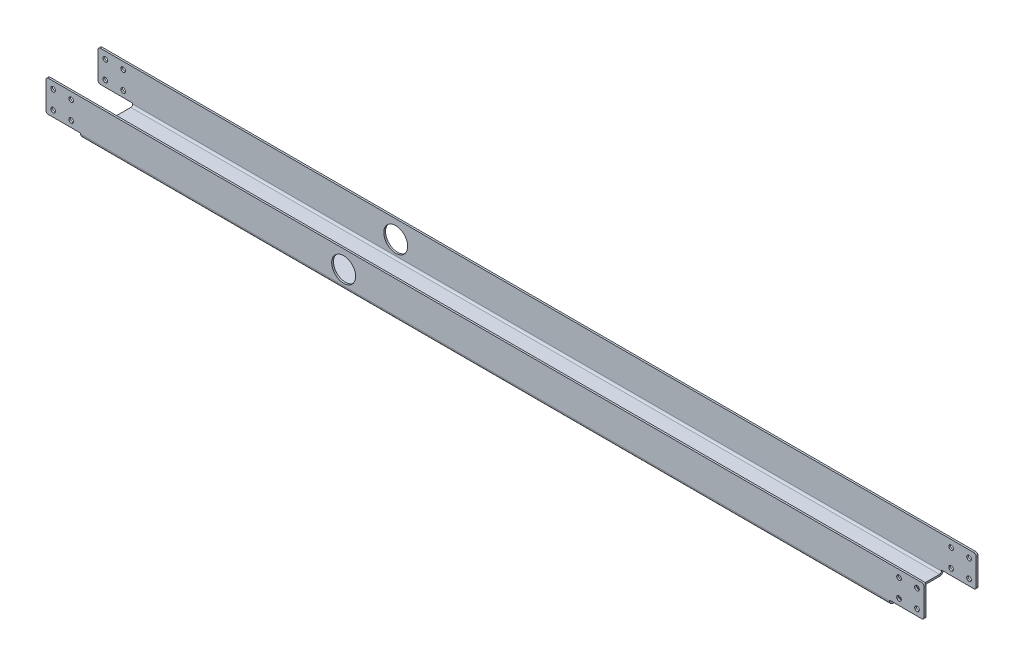
from build123d import *

# Parameters (mm, degrees)
SKETCH1_W                    = 858.52
SKETCH1_H                    = 57.15
BASE_FLANGE1_DEPTH           = 1.89738
EDGE_FLANGE1_STRIP_W         = 11.65352
EDGE_FLANGE1_STRIP_H         = 1.89738
EDGE_FLANGE1_STRIP_CUT_DEPTH = 858.52
EDGE_FLANGE1_DEPTH           = 858.52
EDGE_FLANGE1_FLAT_DEPTH      = 1.89738
EDGE_FLANGE2_STRIP_W         = 11.65352
EDGE_FLANGE2_STRIP_H         = 1.89738
EDGE_FLANGE2_STRIP_CUT_DEPTH = 858.52
EDGE_FLANGE2_DEPTH           = 858.52
EDGE_FLANGE2_FLAT_DEPTH      = 1.89738
SKETCH12_R                   = 2.4638
CUT_EXTRUDE1_DEPTH           = 471.97413973
FILLET1_R                    = 2.54
SKETCH13_R                   = 12.7
CUT_EXTRUDE2_DEPTH           = 471.97413973


# Sheet-metal steps are written as plain solids
with BuildPart() as part:
    # Sketch1 → Base-Flange1 (new body)
    with BuildSketch(Plane(origin=(0, 0, 0), x_dir=(1, 0, 0), z_dir=(0, 1, 0))):
        Rectangle(SKETCH1_W, SKETCH1_H)
    extrude(amount=-BASE_FLANGE1_DEPTH)

    # Edge-Flange1 strip (across the edge) → Edge-Flange1 strip cut (cut)
    with BuildSketch(Plane(origin=(-429.26, 0, 28.575), x_dir=(0, 0, -1), z_dir=(1, 0, 0))):
        with Locations((-1.89738, -0.94869)):
            Rectangle(EDGE_FLANGE1_STRIP_W, EDGE_FLANGE1_STRIP_H)
    extrude(amount=EDGE_FLANGE1_STRIP_CUT_DEPTH, mode=Mode.SUBTRACT)

    # Edge-Flange1 bend section (across the edge) → Edge-Flange1 (add)
    with BuildSketch(Plane(origin=(-429.26, 0, 28.575), x_dir=(0, 0, -1), z_dir=(1, 0, 0))):
        with BuildLine():
            Line((0, 2.032), (1.89738, 2.032))
            ThreePointArc((1.89738, 2.032), (2.492539021, 0.595159021), (3.92938, 0))
            Line((3.92938, 0), (3.92938, -1.89738))
            ThreePointArc((3.92938, -1.89738), (1.150888756, -0.746491244), (0, 2.032))
        make_face()
    extrude(amount=EDGE_FLANGE1_DEPTH)

    # Edge-Flange1 profile (on flange) → Edge-Flange1 flat (add)
    with BuildSketch(Plane(origin=(0, 0, 28.575), x_dir=(-1, 0, 0), z_dir=(0, 0, -1))):
        Polygon((466.09, 36.20262), (-466.09, 36.20262), (-466.09, 2.87782), (-429.26, 2.87782), (-429.26, 2.032), (429.26, 2.032), (429.26, 2.87782), (466.09, 2.87782), align=None)
    extrude(amount=EDGE_FLANGE1_FLAT_DEPTH)

    # Edge-Flange2 strip (across the edge) → Edge-Flange2 strip cut (cut)
    with BuildSketch(Plane(origin=(429.26, 0, -28.575), x_dir=(0, 0, 1), z_dir=(-1, 0, 0))):
        with Locations((-1.89738, -0.94869)):
            Rectangle(EDGE_FLANGE2_STRIP_W, EDGE_FLANGE2_STRIP_H)
    extrude(amount=EDGE_FLANGE2_STRIP_CUT_DEPTH, mode=Mode.SUBTRACT)

    # Edge-Flange2 bend section (across the edge) → Edge-Flange2 (add)
    with BuildSketch(Plane(origin=(429.26, 0, -28.575), x_dir=(0, 0, 1), z_dir=(-1, 0, 0))):
        with BuildLine():
            Line((0, 2.032), (1.89738, 2.032))
            ThreePointArc((1.89738, 2.032), (2.492539021, 0.595159021), (3.92938, 0))
            Line((3.92938, 0), (3.92938, -1.89738))
            ThreePointArc((3.92938, -1.89738), (1.150888756, -0.746491244), (0, 2.032))
        make_face()
    extrude(amount=EDGE_FLANGE2_DEPTH)

    # Edge-Flange2 profile (on flange) → Edge-Flange2 flat (add)
    with BuildSketch(Plane.XY.offset(-28.575)):
        Polygon((466.09, 36.20262), (-466.09, 36.20262), (-466.09, 2.87782), (-429.26, 2.87782), (-429.26, 2.032), (429.26, 2.032), (429.26, 2.87782), (466.09, 2.87782), align=None)
    extrude(amount=EDGE_FLANGE2_FLAT_DEPTH)

    # Sketch12 → Cut-Extrude1 (cut, through all)
    with BuildSketch(Plane.XY.offset(28.575)):
        with Locations((-458.47, 28.58262)):
            Circle(SKETCH12_R)
        with Locations((-458.47, 9.53262)):
            Circle(SKETCH12_R)
        with Locations((-439.42, 28.58262)):
            Circle(SKETCH12_R)
        with Locations((-439.42, 9.53262)):
            Circle(SKETCH12_R)
    cut_extrude1 = extrude(amount=-CUT_EXTRUDE1_DEPTH, mode=Mode.SUBTRACT)

    # Mirror1: Cut-Extrude1 across plane
    add(cut_extrude1.mirror(Plane(origin=(0, 0, 0), x_dir=(0, 0, 1), z_dir=(1, 0, 0))), mode=Mode.SUBTRACT)

    # Fillet1
    fillet1_edges = [part.edges().sort_by_distance(p)[0] for p in [
        (466.09, 2.87782, 27.62631),
        (466.09, 36.20262, 27.62631),
        (-466.09, 36.20262, 27.62631),
        (-466.09, 2.87782, 27.62631),
        (-466.09, 2.87782, -27.62631),
        (-466.09, 36.20262, -27.62631),
        (466.09, 36.20262, -27.62631),
        (466.09, 2.87782, -27.62631),
    ]]
    fillet(fillet1_edges, radius=FILLET1_R)

    # Sketch13 → Cut-Extrude2 (cut, through all)
    with BuildSketch(Plane.XY.offset(28.575)):
        with Locations((-150.114, 17.15262)):
            Circle(SKETCH13_R)
    extrude(amount=-CUT_EXTRUDE2_DEPTH, mode=Mode.SUBTRACT)


solid = part.part
